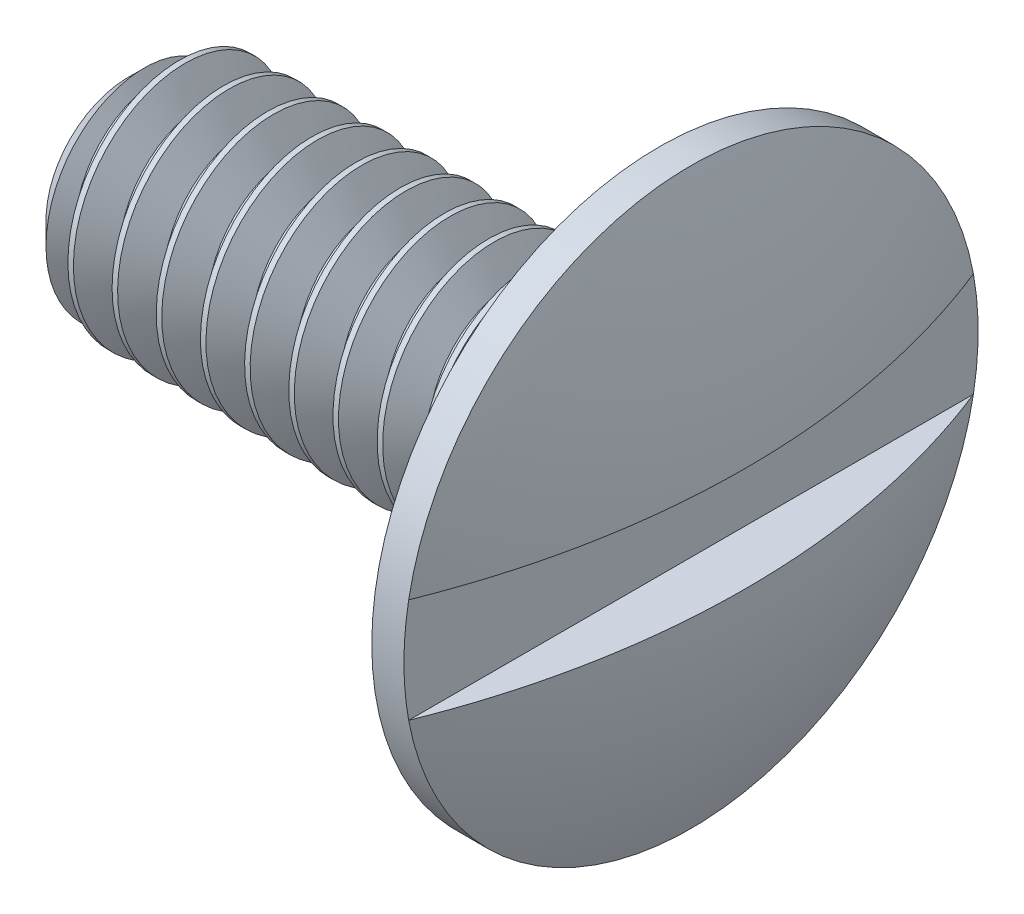
from build123d import *

# Parameters (mm, degrees)
SKETCH2_R           = 2.0828
BOSS_EXTRUDE1_DEPTH = 9.525
CHAMFER1_SIZE       = 0.5953125
CUT_SWEEP1_PITCH    = 0.79375
SKETCH17_W          = 10.31875
SKETCH17_H          = 1.87452
CUT_EXTRUDE5_DEPTH  = 1.010227


with BuildPart() as part:
    # Sketch2 → Boss-Extrude1 (new body)
    with BuildSketch(Plane(origin=(0, 0, 0), x_dir=(0, 0, -1), z_dir=(1, 0, 0))):
        with Locations(Location((0, 0, 0), (0, 0, 180))):
            Circle(SKETCH2_R)
    extrude(amount=BOSS_EXTRUDE1_DEPTH)

    # Chamfer1
    chamfer1_edges = [part.edges().sort_by_distance(p)[0] for p in [
        (0, 0, -2.0828),
    ]]
    chamfer(chamfer1_edges, length=CHAMFER1_SIZE)

    # Cut-Sweep1: the profile of Sketch5 profile screwed along a right-hand helix of 13 turns, 8 arcs to a turn; built about Z, then put on its axis
    cut_sweep1_z = Axis((0, 0, 0), (0, 0, 1))
    cut_sweep1_corners = [(2.0831, 0, 0.000173205), (2.0831, 0, -0.694704455), (1.567244252, 0, -0.396875), (1.567244252, 0, -0.29765625)]
    with BuildLine(mode=Mode.PRIVATE) as cut_sweep1_profile:
        Line(cut_sweep1_corners[0], cut_sweep1_corners[1])
        Line(cut_sweep1_corners[1], cut_sweep1_corners[2])
        Line(cut_sweep1_corners[2], cut_sweep1_corners[3])
        Line(cut_sweep1_corners[3], cut_sweep1_corners[0])
    cut_sweep1_cap = Face(cut_sweep1_profile.wire())
    cut_sweep1_turn_angles = [0, 22.5, 45, 67.5, 90, 112.5, 135, 157.5, 180, 202.5, 225, 247.5, 270, 292.5, 315, 337.5, 360]
    cut_sweep1_turn_weights = [1, 0.9238795325112867, 1, 0.9238795325112867, 1, 0.9238795325112867, 1, 0.9238795325112867, 1, 0.9238795325112867, 1, 0.9238795325112867, 1, 0.9238795325112867, 1, 0.9238795325112867, 1]
    cut_sweep1_turn_rails = [Edge.make_bspline([Vector(p[0], p[1], 0).rotate(cut_sweep1_z, cut_sweep1_turn_angles[k]) / cut_sweep1_turn_weights[k] + Vector(0, 0, p[2] + CUT_SWEEP1_PITCH * cut_sweep1_turn_angles[k] / 360) for k in range(17)], [0, 0, 0, 1, 1, 2, 2, 3, 3, 4, 4, 5, 5, 6, 6, 7, 7, 8, 8, 8], 2, cut_sweep1_turn_weights) for p in cut_sweep1_corners]
    cut_sweep1_turn_sides = [Face.make_surface_from_curves(cut_sweep1_turn_rails[p[0]], cut_sweep1_turn_rails[p[1]]) for p in [(0, 1), (1, 2), (2, 3), (3, 0)]]
    cut_sweep1 = Plane(origin=(0, 0, 0), x_dir=(0, 1, 0), z_dir=(1, 0, 0)) * Solid(Shell([*[p.moved(Location((0, 0, CUT_SWEEP1_PITCH * i))) for i in range(13) for p in cut_sweep1_turn_sides], cut_sweep1_cap, cut_sweep1_cap.rotate(cut_sweep1_z, 4680).moved(Location((0, 0, CUT_SWEEP1_PITCH * 4680 / 360)))]))
    add(cut_sweep1, mode=Mode.SUBTRACT)


with BuildPart() as body_2:
    # Sketch6 → Revolve1 (revolve)
    with BuildSketch(Plane.XY):
        with BuildLine():
            Line((9.525, 0), (9.525, 5.159375))
            Line((9.525, 5.159375), (10.102272727, 5.159375))
            ThreePointArc((10.102272727, 5.159375), (10.857567791, 2.628674073), (11.1125, 0))
            Line((11.1125, 0), (9.525, 0))
        make_face()
    revolve(axis=Axis((9.525, 0, 0), (1, 0, 0)))

    # Sketch17 → Cut-Extrude5 (cut)
    with BuildSketch(Plane(origin=(11.1125, 0, 0), x_dir=(0, 0, -1), z_dir=(1, 0, 0))):
        Rectangle(SKETCH17_W, SKETCH17_H)
    extrude(amount=-CUT_EXTRUDE5_DEPTH, mode=Mode.SUBTRACT)

    # Combine2: union part
    add(part.part)


solid = body_2.part
